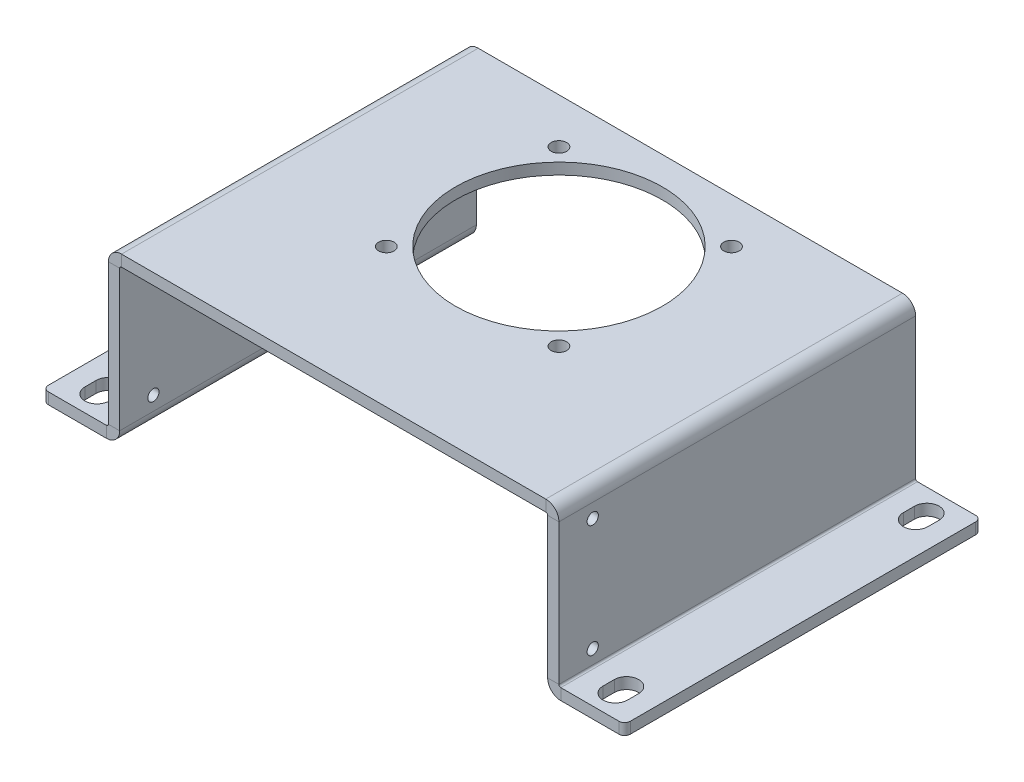
from build123d import *

# Parameters (mm, degrees)
BASE_FLANGE1_DEPTH = 190
CUT_EXTRUDE1_REACH = 376.327
SKETCH6_R          = 55.1
SKETCH6_R_2        = 4.1
CUT_EXTRUDE2_REACH = 374.946
FILLET1_R          = 3
CUT_EXTRUDE3_REACH = 346.404
SKETCH8_R          = 3


# Sheet-metal steps are written as plain solids
with BuildPart() as part:
    # Sketch1 → Base-Flange1 (new body)
    with BuildSketch(Plane.XY):
        with BuildLine():
            Line((0, 0), (34, 0))
            ThreePointArc((34, 0), (34.707106781, 0.292893219), (35, 1))
            Line((35, 1), (35, 76))
            ThreePointArc((35, 76), (37.050252532, 80.949747468), (42, 83))
            Line((42, 83), (268, 83))
            ThreePointArc((268, 83), (272.949747468, 80.949747468), (275, 76))
            Line((275, 76), (275, 1))
            ThreePointArc((275, 1), (275.292893219, 0.292893219), (276, 0))
            Line((276, 0), (310, 0))
            Line((310, 0), (310, -6))
            Line((310, -6), (276, -6))
            ThreePointArc((276, -6), (271.050252532, -3.949747468), (269, 1))
            Line((269, 1), (269, 76))
            ThreePointArc((269, 76), (268.707106781, 76.707106781), (268, 77))
            Line((268, 77), (42, 77))
            ThreePointArc((42, 77), (41.292893219, 76.707106781), (41, 76))
            Line((41, 76), (41, 1))
            ThreePointArc((41, 1), (38.949747468, -3.949747468), (34, -6))
            Line((34, -6), (0, -6))
            Line((0, -6), (0, 0))
        make_face()
    extrude(amount=BASE_FLANGE1_DEPTH)

    # Sketch6 → Cut-Extrude1 (cut, up to next)
    with BuildSketch(Plane(origin=(0, 83, 0), x_dir=(1, 0, 0), z_dir=(0, 1, 0)), mode=Mode.PRIVATE) as cut_extrude1_sk1:
        with Locations(Location((155, -70, 0), (0, 0, 270))):
            Circle(SKETCH6_R)
    cut_extrude1_tool1 = extrude(cut_extrude1_sk1.sketch, amount=-CUT_EXTRUDE1_REACH, mode=Mode.PRIVATE) & part.part
    # Sketch6 → Cut-Extrude1 (cut, up to next)
    with BuildSketch(Plane(origin=(0, 83, 0), x_dir=(1, 0, 0), z_dir=(0, 1, 0)), mode=Mode.PRIVATE) as cut_extrude1_sk2:
        with Locations(Location((200.961940777, -24.038059223, 0), (0, 0, 270))):
            Circle(SKETCH6_R_2)
    cut_extrude1_tool2 = extrude(cut_extrude1_sk2.sketch, amount=-CUT_EXTRUDE1_REACH, mode=Mode.PRIVATE) & part.part
    # Sketch6 → Cut-Extrude1 (cut, up to next)
    with BuildSketch(Plane(origin=(0, 83, 0), x_dir=(1, 0, 0), z_dir=(0, 1, 0)), mode=Mode.PRIVATE) as cut_extrude1_sk3:
        with Locations(Location((200.961940777, -115.961940777, 0), (0, 0, 270))):
            Circle(SKETCH6_R_2)
    cut_extrude1_tool3 = extrude(cut_extrude1_sk3.sketch, amount=-CUT_EXTRUDE1_REACH, mode=Mode.PRIVATE) & part.part
    # Sketch6 → Cut-Extrude1 (cut, up to next)
    with BuildSketch(Plane(origin=(0, 83, 0), x_dir=(1, 0, 0), z_dir=(0, 1, 0)), mode=Mode.PRIVATE) as cut_extrude1_sk4:
        with Locations(Location((109.038059223, -24.038059223, 0), (0, 0, 270))):
            Circle(SKETCH6_R_2)
    cut_extrude1_tool4 = extrude(cut_extrude1_sk4.sketch, amount=-CUT_EXTRUDE1_REACH, mode=Mode.PRIVATE) & part.part
    # Sketch6 → Cut-Extrude1 (cut, up to next)
    with BuildSketch(Plane(origin=(0, 83, 0), x_dir=(1, 0, 0), z_dir=(0, 1, 0)), mode=Mode.PRIVATE) as cut_extrude1_sk5:
        with Locations(Location((109.038059223, -115.961940777, 0), (0, 0, 270))):
            Circle(SKETCH6_R_2)
    cut_extrude1_tool5 = extrude(cut_extrude1_sk5.sketch, amount=-CUT_EXTRUDE1_REACH, mode=Mode.PRIVATE) & part.part
    add(cut_extrude1_tool1.solids().sort_by_distance((155, 83, 70))[0], mode=Mode.SUBTRACT)
    add(cut_extrude1_tool2.solids().sort_by_distance((200.961941, 83, 24.038059))[0], mode=Mode.SUBTRACT)
    add(cut_extrude1_tool3.solids().sort_by_distance((200.961941, 83, 115.961941))[0], mode=Mode.SUBTRACT)
    add(cut_extrude1_tool4.solids().sort_by_distance((109.038059, 83, 24.038059))[0], mode=Mode.SUBTRACT)
    add(cut_extrude1_tool5.solids().sort_by_distance((109.038059, 83, 115.961941))[0], mode=Mode.SUBTRACT)

    # Sketch7 → Cut-Extrude2 (cut, up to next)
    with BuildSketch(Plane(origin=(0, 0, 0), x_dir=(1, 0, 0), z_dir=(0, 1, 0)), mode=Mode.PRIVATE) as cut_extrude2_sk1:
        with BuildLine():
            Line((299.5, -12), (299.5, -18))
            ThreePointArc((299.5, -18), (293, -24.5), (286.5, -18))
            Line((286.5, -18), (286.5, -12))
            ThreePointArc((286.5, -12), (293, -5.5), (299.5, -12))
        make_face()
    cut_extrude2_tool1 = extrude(cut_extrude2_sk1.sketch, amount=-CUT_EXTRUDE2_REACH, mode=Mode.PRIVATE) & part.part
    # Sketch7 → Cut-Extrude2 (cut, up to next)
    with BuildSketch(Plane(origin=(0, 0, 0), x_dir=(1, 0, 0), z_dir=(0, 1, 0)), mode=Mode.PRIVATE) as cut_extrude2_sk2:
        with BuildLine():
            Line((299.5, -178), (299.5, -172))
            ThreePointArc((299.5, -172), (293, -165.5), (286.5, -172))
            Line((286.5, -172), (286.5, -178))
            ThreePointArc((286.5, -178), (293, -184.5), (299.5, -178))
        make_face()
    cut_extrude2_tool2 = extrude(cut_extrude2_sk2.sketch, amount=-CUT_EXTRUDE2_REACH, mode=Mode.PRIVATE) & part.part
    # Sketch7 → Cut-Extrude2 (cut, up to next)
    with BuildSketch(Plane(origin=(0, 0, 0), x_dir=(1, 0, 0), z_dir=(0, 1, 0)), mode=Mode.PRIVATE) as cut_extrude2_sk3:
        with BuildLine():
            Line((10.5, -178), (10.5, -172))
            ThreePointArc((10.5, -172), (17, -165.5), (23.5, -172))
            Line((23.5, -172), (23.5, -178))
            ThreePointArc((23.5, -178), (17, -184.5), (10.5, -178))
        make_face()
    cut_extrude2_tool3 = extrude(cut_extrude2_sk3.sketch, amount=-CUT_EXTRUDE2_REACH, mode=Mode.PRIVATE) & part.part
    # Sketch7 → Cut-Extrude2 (cut, up to next)
    with BuildSketch(Plane(origin=(0, 0, 0), x_dir=(1, 0, 0), z_dir=(0, 1, 0)), mode=Mode.PRIVATE) as cut_extrude2_sk4:
        with BuildLine():
            Line((10.5, -12), (10.5, -18))
            ThreePointArc((10.5, -18), (17, -24.5), (23.5, -18))
            Line((23.5, -18), (23.5, -12))
            ThreePointArc((23.5, -12), (17, -5.5), (10.5, -12))
        make_face()
    cut_extrude2_tool4 = extrude(cut_extrude2_sk4.sketch, amount=-CUT_EXTRUDE2_REACH, mode=Mode.PRIVATE) & part.part
    add(cut_extrude2_tool1.solids().sort_by_distance((293, 0, 15))[0], mode=Mode.SUBTRACT)
    add(cut_extrude2_tool2.solids().sort_by_distance((293, 0, 175))[0], mode=Mode.SUBTRACT)
    add(cut_extrude2_tool3.solids().sort_by_distance((17, 0, 175))[0], mode=Mode.SUBTRACT)
    add(cut_extrude2_tool4.solids().sort_by_distance((17, 0, 15))[0], mode=Mode.SUBTRACT)

    # Fillet1
    fillet1_edges = [part.edges().sort_by_distance(p)[0] for p in [
        (0, -3, 0),
        (310, -3, 0),
        (0, -3, 190),
        (310, -3, 190),
    ]]
    fillet(fillet1_edges, radius=FILLET1_R)

    # Cut-Extrude3: up to this face of the body (flat: up to its plane)
    cut_extrude3_end = Plane(part.part.faces().sort_by_distance((35, 38.5, 95))[0])
    # Sketch8 → Cut-Extrude3 (cut, up to the picked face)
    with BuildSketch(Plane(origin=(275, 0, 0), x_dir=(0, 0, -1), z_dir=(1, 0, 0)), mode=Mode.PRIVATE) as cut_extrude3_sk1:
        with Locations((-172, 68.5)):
            Circle(SKETCH8_R)
    cut_extrude3_tool1 = split(extrude(cut_extrude3_sk1.sketch, amount=-CUT_EXTRUDE3_REACH, mode=Mode.PRIVATE), bisect_by=cut_extrude3_end, keep=Keep.BOTH, mode=Mode.PRIVATE)
    # Sketch8 → Cut-Extrude3 (cut, up to the picked face)
    with BuildSketch(Plane(origin=(275, 0, 0), x_dir=(0, 0, -1), z_dir=(1, 0, 0)), mode=Mode.PRIVATE) as cut_extrude3_sk2:
        with Locations((-172, 8.5)):
            Circle(SKETCH8_R)
    cut_extrude3_tool2 = split(extrude(cut_extrude3_sk2.sketch, amount=-CUT_EXTRUDE3_REACH, mode=Mode.PRIVATE), bisect_by=cut_extrude3_end, keep=Keep.BOTH, mode=Mode.PRIVATE)
    add(cut_extrude3_tool1.solids().sort_by(Axis((275, 68.5, 172), (-1, 0, 0)))[0], mode=Mode.SUBTRACT)
    add(cut_extrude3_tool2.solids().sort_by(Axis((275, 8.5, 172), (-1, 0, 0)))[0], mode=Mode.SUBTRACT)


solid = part.part
